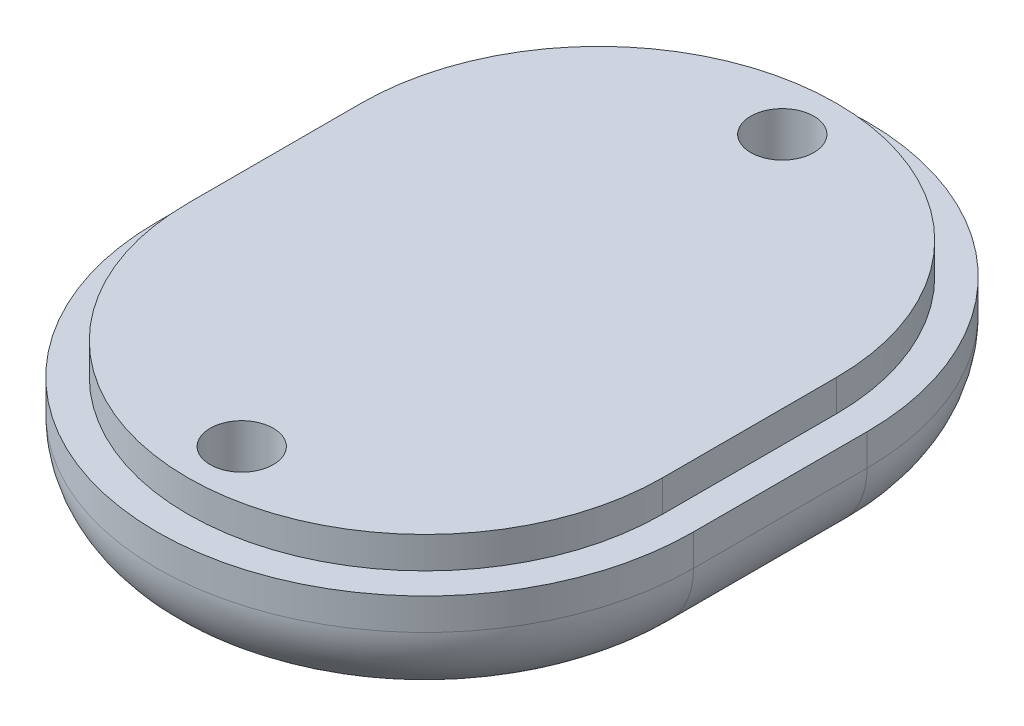
from build123d import *

# Parameters (mm, degrees)
SKETCH1_R           = 2
BOSS_EXTRUDE1_DEPTH = 2
BOSS_EXTRUDE2_DEPTH = 2
BOSS_EXTRUDE3_DEPTH = 5
FILLET2_R           = 5
CUT_EXTRUDE1_START  = -7
SKETCH4_R           = 2
CUT_EXTRUDE1_DEPTH  = 7
SKETCH5_R           = 3.3
CUT_EXTRUDE2_DEPTH  = 5


with BuildPart() as part:
    # Sketch1 → Boss-Extrude1 (new body)
    with BuildSketch(Plane(origin=(0, 0, 0), x_dir=(1, 0, 0), z_dir=(0, 1, 0))):
        with BuildLine():
            Line((15.05, -21.5), (15.05, -10.5))
            ThreePointArc((15.05, -10.5), (0, 4.549999995), (-15.05, -10.5))
            Line((-15.05, -10.5), (-15.05, -21.5))
            ThreePointArc((-15.05, -21.5), (0, -36.55), (15.05, -21.5))
        make_face()
        with Locations(Location((0, 1.124208827, 0), (0, 0, 270))):
            Circle(SKETCH1_R, mode=Mode.SUBTRACT)
        with Locations(Location((0, -33.124208832, 0), (0, 0, 270))):
            Circle(SKETCH1_R, mode=Mode.SUBTRACT)
    extrude(amount=BOSS_EXTRUDE1_DEPTH)

    # Sketch2 → Boss-Extrude2 (add)
    with BuildSketch(Plane.XZ):
        with BuildLine():
            Line((17, 10.499999999), (17, 21.5))
            ThreePointArc((17, 21.5), (0, 38.5), (-17, 21.5))
            Line((-17, 21.5), (-17, 10.5))
            ThreePointArc((-17, 10.5), (0, -6.499999995), (17, 10.499999999))
        make_face()
    extrude(amount=BOSS_EXTRUDE2_DEPTH)


with BuildPart() as body_2:
    # Sketch3 → Boss-Extrude3 (new body)
    with BuildSketch(Plane.XZ.offset(2)):
        with BuildLine():
            Line((-17, 21.5), (-17, 10.500000005))
            ThreePointArc((-17, 10.500000005), (0, -6.499999995), (17, 10.500000005))
            Line((17, 10.500000005), (17, 21.5))
            ThreePointArc((17, 21.5), (0, 38.5), (-17, 21.5))
        make_face()
    extrude(amount=BOSS_EXTRUDE3_DEPTH)

    # Fillet2
    fillet2_edges = [body_2.edges().sort_by_distance(p)[0] for p in [
        (17, -7, 16.000000003),
        (-17, -7, 16.000000003),
        (0, -7, -6.499999995),
        (0, -7, 38.5),
    ]]
    fillet(fillet2_edges, radius=FILLET2_R - 0.0001)  # a hair under: the kernel refuses the full size


with BuildPart() as cut_extrude1_tool:
    # Sketch4 → Cut-Extrude1 (new body)
    with BuildSketch(Plane(origin=(0, 0, 0), x_dir=(1, 0, 0), z_dir=(0, 1, 0)).offset(CUT_EXTRUDE1_START)):
        with Locations(Location((0, 1.124208827, 0), (0, 0, 173.978283806))):
            Circle(SKETCH4_R)
        with Locations(Location((0, -33.124208832, 0), (0, 0, 353.978283806))):
            Circle(SKETCH4_R)
    extrude(amount=CUT_EXTRUDE1_DEPTH)


with BuildPart() as part_1:
    add(part.part)

    # Cut-Extrude1: cut by cut_extrude1_tool
    add(cut_extrude1_tool.part, mode=Mode.SUBTRACT)


with BuildPart() as body_2_1:
    add(body_2.part)

    # Cut-Extrude1: cut by cut_extrude1_tool
    add(cut_extrude1_tool.part, mode=Mode.SUBTRACT)

    # Sketch5 → Cut-Extrude2 (cut)
    with BuildSketch(Plane.XZ.offset(2)):
        with Locations(Location((0, 33.124208832, 0), (0, 0, 358.49705556))):
            Circle(SKETCH5_R)
        with Locations(Location((0, -1.124208827, 0), (0, 0, 1.50294444))):
            Circle(SKETCH5_R)
    extrude(amount=CUT_EXTRUDE2_DEPTH, mode=Mode.SUBTRACT)


solid = Compound([part_1.part, body_2_1.part])
